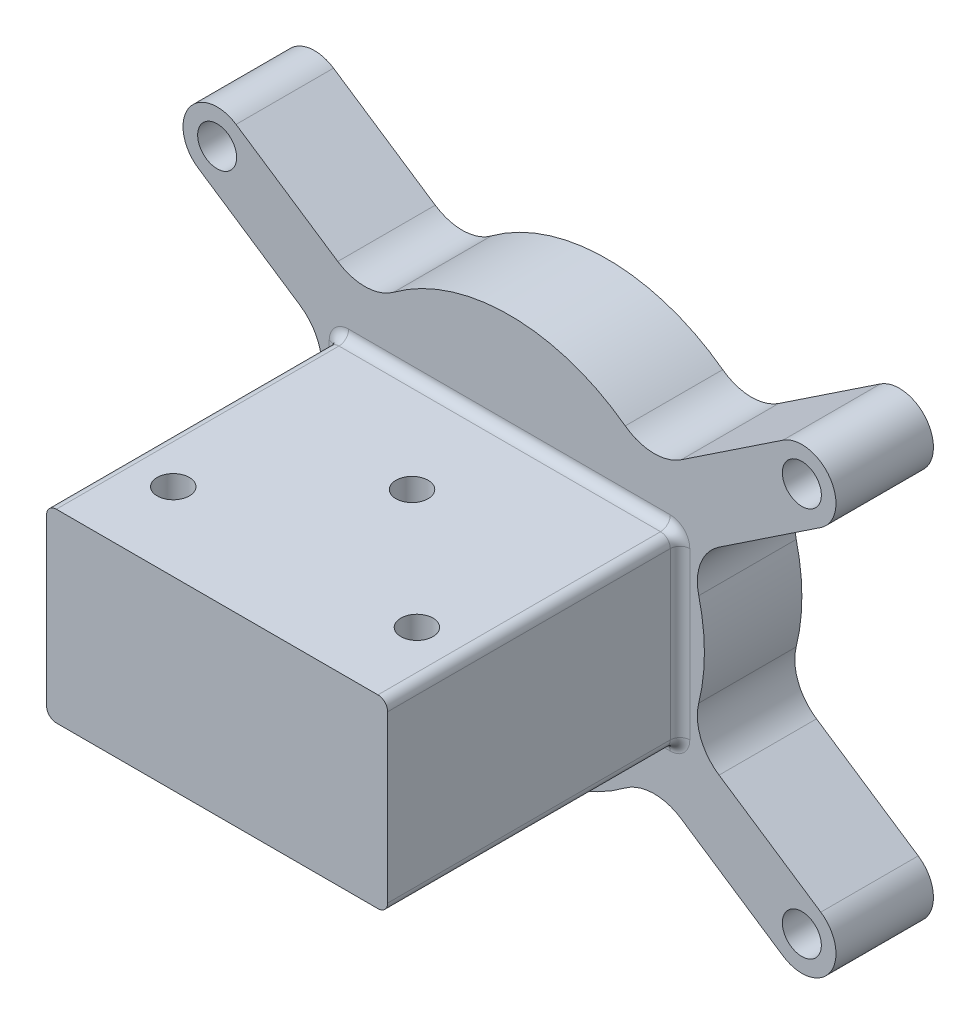
from build123d import *

# Parameters (mm, degrees)
BASE_FLANGE1_DEPTH        = 10
F_4_0MM_DOWEL_HOLE1_D     = 4
F_4_0MM_DOWEL_HOLE1_DEPTH = 16
F_4_0MM_DOWEL_HOLE1_TIP   = 1.201721238
FILLET1_R                 = 5
F_4_0MM_DOWEL_HOLE2_D     = 4
F_4_0MM_DOWEL_HOLE2_DEPTH = 16
F_4_0MM_DOWEL_HOLE2_TIP   = 1.201721238
SKETCH17_W                = 35
SKETCH17_H                = 19
BOSS_EXTRUDE1_DEPTH       = 30
SKETCH18_R                = 1.65
CUT_EXTRUDE1_DEPTH        = 56.778580118
FILLET2_R                 = 1


# Sheet-metal steps are written as plain solids
with BuildPart() as part:
    # Sketch1 → Base-Flange1 (new body)
    with BuildSketch(Plane.XY):
        with BuildLine():
            Line((14.442758409, 13.834982094), (28.058549313, 22.91217603))
            ThreePointArc((28.058549313, 22.91217603), (32.91217603, 21.941450687), (31.941450687, 17.08782397))
            Line((31.941450687, 17.08782397), (18.325659783, 8.010630034))
            ThreePointArc((18.325659783, 8.010630034), (20, 0), (18.325659783, -8.010630034))
            Line((18.325659783, -8.010630034), (31.941450687, -17.08782397))
            ThreePointArc((31.941450687, -17.08782397), (32.91217603, -21.941450687), (28.058549313, -22.91217603))
            Line((28.058549313, -22.91217603), (14.442758409, -13.834982094))
            ThreePointArc((14.442758409, -13.834982094), (0, -20), (-14.442758409, -13.834982094))
            Line((-14.442758409, -13.834982094), (-28.058549313, -22.91217603))
            ThreePointArc((-28.058549313, -22.91217603), (-32.91217603, -21.941450687), (-31.941450687, -17.08782397))
            Line((-31.941450687, -17.08782397), (-18.325659783, -8.010630034))
            ThreePointArc((-18.325659783, -8.010630034), (-20, 0), (-18.325659783, 8.010630034))
            Line((-18.325659783, 8.010630034), (-31.941450687, 17.08782397))
            ThreePointArc((-31.941450687, 17.08782397), (-32.91217603, 21.941450687), (-28.058549313, 22.91217603))
            Line((-28.058549313, 22.91217603), (-14.442758409, 13.834982094))
            ThreePointArc((-14.442758409, 13.834982094), (0, 20), (14.442758409, 13.834982094))
        make_face()
    extrude(amount=-BASE_FLANGE1_DEPTH)

    # Ø4.0mm Dowel Hole1
    with Locations(Plane.XY):
        with Locations((-30, 20), (30, -20), (-30, -20), (30, 20)):
            Hole(F_4_0MM_DOWEL_HOLE1_D / 2, depth=F_4_0MM_DOWEL_HOLE1_DEPTH)
            with Locations((0, 0, -(F_4_0MM_DOWEL_HOLE1_DEPTH + F_4_0MM_DOWEL_HOLE1_TIP / 2))):  # 118° drill point
                Cone(0, F_4_0MM_DOWEL_HOLE1_D / 2, F_4_0MM_DOWEL_HOLE1_TIP, mode=Mode.SUBTRACT)

    # Fillet1
    fillet1_edges = [part.edges().sort_by_distance(p)[0] for p in [
        (18.325659783, 8.010630034, -5),
        (18.325659783, -8.010630034, -5),
        (14.442758409, -13.834982094, -5),
        (-14.442758409, -13.834982094, -5),
        (-18.325659783, -8.010630034, -5),
        (-18.325659783, 8.010630034, -5),
        (-14.442758409, 13.834982094, -5),
        (14.442758409, 13.834982094, -5),
    ]]
    fillet(fillet1_edges, radius=FILLET1_R)

    # Ø4.0mm Dowel Hole2
    with Locations(Plane(origin=(0, 0, -10), x_dir=(-1, 0, 0), z_dir=(0, 0, -1))):
        with Locations((0, 0)):
            Hole(F_4_0MM_DOWEL_HOLE2_D / 2, depth=F_4_0MM_DOWEL_HOLE2_DEPTH)
            with Locations((0, 0, -(F_4_0MM_DOWEL_HOLE2_DEPTH + F_4_0MM_DOWEL_HOLE2_TIP / 2))):  # 118° drill point
                Cone(0, F_4_0MM_DOWEL_HOLE2_D / 2, F_4_0MM_DOWEL_HOLE2_TIP, mode=Mode.SUBTRACT)

    # Sketch17 → Boss-Extrude1 (add)
    with BuildSketch(Plane.XY):
        Rectangle(SKETCH17_W, SKETCH17_H)
    extrude(amount=BOSS_EXTRUDE1_DEPTH)

    # Sketch18 → Cut-Extrude1 (cut, through all)
    with BuildSketch(Plane(origin=(0, 9.5, 0), x_dir=(1, 0, 0), z_dir=(0, 1, 0))):
        with Locations(Location((0, -10, 0), (0, 0, 270))):
            Circle(SKETCH18_R)
        with Locations(Location((-12.5, -22, 0), (0, 0, 270))):
            Circle(SKETCH18_R)
        with Locations(Location((12.5, -22, 0), (0, 0, 270))):
            Circle(SKETCH18_R)
    extrude(amount=-CUT_EXTRUDE1_DEPTH, mode=Mode.SUBTRACT)

    # Fillet2
    fillet2_edges = [part.edges().sort_by_distance(p)[0] for p in [
        (17.5, 0, 0),
        (17.5, -9.5, 15),
        (0, 9.5, 0),
        (17.5, 9.5, 15),
        (-17.5, 0, 0),
        (-17.5, 9.5, 15),
        (0, -9.5, 0),
        (-17.5, -9.5, 15),
    ]]
    fillet(fillet2_edges, radius=FILLET2_R)


solid = part.part
